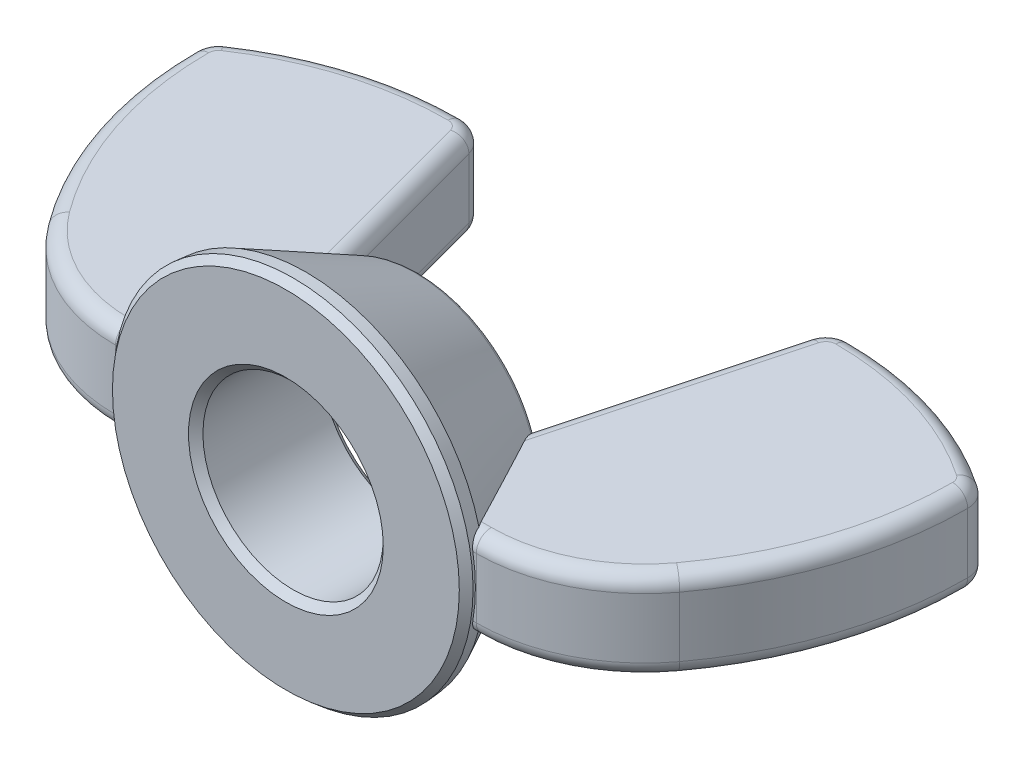
from build123d import *

# Parameters (mm, degrees)
EXTRUDE2_DEPTH      = 1.25
SKETCH3_R           = 5
EXTRUDE1_DEPTH      = 0.55566
EXTRUDE1_DRAFT      = -5
SKETCH15_R          = 4.951386049
EXTRUDE3_DEPTH      = 3.14874
EXTRUDE3_TAPER      = 26.698437176
FILLET3_R           = 0.254
SKETCH4_R           = 2.5
CUT_EXTRUDE1_DEPTH  = 16.684929072
SWEEP1_PITCH        = 0.8
SKETCH7_R           = 5
CUT_EXTRUDE2_DEPTH  = 16.684929104
SKETCH8_R           = 4.951386049
CUT_EXTRUDE3_DEPTH  = 14.546328962
SKETCH11_R          = 2.4492
CUT_EXTRUDE5_DEPTH  = 14.546328926
CUT_EXTRUDE5_TAPER  = 45
CHAMFER1_SIZE       = 0.2083725
CHAMFER1_SIZE2      = 0.192340809
FILLET4_R           = 0.416666667
SKETCH18_R          = 3.211270087
BOSS_EXTRUDE3_DEPTH = 3.7044
SKETCH19_R          = 2.5
CUT_EXTRUDE6_DEPTH  = 3.7044
CHAMFER2_SIZE       = 0.2


with BuildPart() as part:
    # Sketch13 → Extrude2 (new, symmetric)
    with BuildSketch(Plane(origin=(0, 0, 0), x_dir=(1, 0, 0), z_dir=(0, 1, 0))):
        with BuildLine():
            Line((3.074810737, 0.27783), (5, 0.27783))
            ThreePointArc((5, 0.27783), (7.099129938, 0.776746992), (8.749295866, 2.166789103))
            ThreePointArc((8.749295866, 2.166789103), (10.222034162, 5.009156698), (10.73, 8.169850029))
            ThreePointArc((10.73, 8.169850029), (10.648713606, 8.495871948), (10.423883961, 8.745570566))
            ThreePointArc((10.423883961, 8.745570566), (8.013491694, 9.895268701), (5.372282902, 10.29))
            ThreePointArc((5.372282902, 10.29), (4.94953191, 10.146495375), (4.701501078, 9.775291004))
            Line((4.701501078, 9.775291004), (3.074810737, 3.7044))
            Line((3.074810737, 3.7044), (3.074810737, 0.27783))
        make_face()
    extrude(amount=EXTRUDE2_DEPTH, both=True)

    # Fillet4
    fillet4_edges = [part.edges().sort_by_distance(p)[0] for p in [
        (7.099129938, 1.25, -0.776746992),
        (10.222034162, 1.25, -5.009156698),
        (10.648713606, 1.25, -8.495871948),
        (8.013491694, 1.25, -9.895268701),
        (4.94953191, 1.25, -10.146495375),
        (3.888155907, 1.25, -6.739845502),
        (3.888155907, -1.25, -6.739845502),
        (4.037405368, 1.25, -0.27783),
        (4.94953191, -1.25, -10.146495375),
        (8.013491694, -1.25, -9.895268701),
        (10.648713606, -1.25, -8.495871948),
        (10.222034162, -1.25, -5.009156698),
        (7.099129938, -1.25, -0.776746992),
        (4.037405368, -1.25, -0.27783),
    ]]
    fillet(fillet4_edges, radius=FILLET4_R)


with BuildPart() as body_2:
    # Sketch3 → Extrude1 (with draft: the straight prism first)
    with BuildSketch(Plane.XY):
        Circle(SKETCH3_R)
    extrude(amount=-EXTRUDE1_DEPTH)
    # Extrude1: the draft: its side faces are tilted about the plane it starts from
    extrude1_sides = [body_2.faces().sort_by_distance(p)[0] for p in [
        (-5, 0, -0.27783),
    ]]
    draft(extrude1_sides, Plane.XY, EXTRUDE1_DRAFT)

    # Sketch15 → Extrude3 (add)
    with BuildSketch(Plane(origin=(0, 0, -0.55566), x_dir=(-1, 0, 0), z_dir=(0, 0, -1))):
        Circle(SKETCH15_R)
    extrude(amount=EXTRUDE3_DEPTH, taper=EXTRUDE3_TAPER)

    # Fillet3
    fillet3_edges = [body_2.edges().sort_by_distance(p)[0] for p in [
        (3.367842423, 0, -3.7044),
    ]]
    fillet(fillet3_edges, radius=FILLET3_R)

    # Sketch4 → Cut-Extrude1 (cut, through all)
    with BuildSketch(Plane.XY):
        Circle(SKETCH4_R)
    extrude(amount=-CUT_EXTRUDE1_DEPTH, mode=Mode.SUBTRACT)

    # Sweep1: the profile of Sketch6 profile screwed along a right-hand helix of 7.1305 turns, 6 arcs to a turn; built about Z, then put on its axis
    sweep1_z = Axis((0, 0, 0), (0, 0, 1))
    sweep1_corners = [(2.5003, 0, -0.700173205), (1.980384758, 0, -0.4), (1.980384758, 0, -0.3), (2.5003, 0, 0.000173205)]
    with BuildLine(mode=Mode.PRIVATE) as sweep1_profile:
        Line(sweep1_corners[0], sweep1_corners[1])
        Line(sweep1_corners[1], sweep1_corners[2])
        Line(sweep1_corners[2], sweep1_corners[3])
        Line(sweep1_corners[3], sweep1_corners[0])
    sweep1_cap = Face(sweep1_profile.wire())
    sweep1_turn_angles = [0, 30, 60, 90, 120, 150, 180, 210, 240, 270, 300, 330, 360]
    sweep1_turn_weights = [1, 0.8660254037844387, 1, 0.8660254037844387, 1, 0.8660254037844387, 1, 0.8660254037844387, 1, 0.8660254037844387, 1, 0.8660254037844387, 1]
    sweep1_turn_rails = [Edge.make_bspline([Vector(p[0], p[1], 0).rotate(sweep1_z, sweep1_turn_angles[k]) / sweep1_turn_weights[k] + Vector(0, 0, p[2] + SWEEP1_PITCH * sweep1_turn_angles[k] / 360) for k in range(13)], [0, 0, 0, 1, 1, 2, 2, 3, 3, 4, 4, 5, 5, 6, 6, 6], 2, sweep1_turn_weights) for p in sweep1_corners]
    sweep1_turn_sides = [Face.make_surface_from_curves(sweep1_turn_rails[p[0]], sweep1_turn_rails[p[1]]) for p in [(0, 1), (1, 2), (2, 3), (3, 0)]]
    sweep1_last_angles = [2520, 2543.49, 2566.98]
    sweep1_last_weights = [1, 0.9171296552585544, 1]
    sweep1_last_rails = [Edge.make_bspline([Vector(p[0], p[1], 0).rotate(sweep1_z, sweep1_last_angles[k]) / sweep1_last_weights[k] + Vector(0, 0, p[2] + SWEEP1_PITCH * sweep1_last_angles[k] / 360) for k in range(3)], [0, 0, 0, 1, 1, 1], 2, sweep1_last_weights) for p in sweep1_corners]
    sweep1_last_sides = [Face.make_surface_from_curves(sweep1_last_rails[p[0]], sweep1_last_rails[p[1]]) for p in [(0, 1), (1, 2), (2, 3), (3, 0)]]
    sweep1 = Plane(origin=(0, 0, 0), x_dir=(-1, 0, 0), z_dir=(0, 0, -1)) * Solid(Shell([*[p.moved(Location((0, 0, SWEEP1_PITCH * i))) for i in range(7) for p in sweep1_turn_sides], *sweep1_last_sides, sweep1_cap, sweep1_cap.rotate(sweep1_z, 2566.98).moved(Location((0, 0, SWEEP1_PITCH * 2566.98 / 360)))]))
    add(sweep1)

    # Sketch7 → Cut-Extrude2 (cut, through all)
    with BuildSketch(Plane.XY):
        Circle(SKETCH7_R)
    extrude(amount=CUT_EXTRUDE2_DEPTH, mode=Mode.SUBTRACT)

    # Sketch8 → Cut-Extrude3 (cut, through all)
    with BuildSketch(Plane.XY.offset(-3.7044)):
        Circle(SKETCH8_R)
    extrude(amount=-CUT_EXTRUDE3_DEPTH, mode=Mode.SUBTRACT)

    # Cut-Extrude4 cone 1 section (through the dimple's axis) → Cut-Extrude4 (revolve, cut)
    with BuildSketch(Plane(origin=(0, 0, 0), x_dir=(0, -1, 0), z_dir=(1, 0, 0))):
        Polygon((0, 0), (2.5, 0), (0, 2.5), align=None)
    revolve(axis=Axis((0, 0, 0), (0, 0, -1)), mode=Mode.SUBTRACT)

    # Sketch11 → Cut-Extrude5 (cut, through all)
    with BuildSketch(Plane.XY.offset(-3.7044)):
        Circle(SKETCH11_R)
    extrude(amount=CUT_EXTRUDE5_DEPTH, taper=CUT_EXTRUDE5_TAPER, mode=Mode.SUBTRACT)

    # Chamfer1
    chamfer1_edges = [body_2.edges().sort_by_distance(p)[0] for p in [
        (-5, 0, 0),
    ]]
    chamfer1_side = [body_2.faces().sort_by_distance(p)[0] for p in [
        (-4.975693025, 0, -0.27783),
    ]]
    chamfer(chamfer1_edges, length=CHAMFER1_SIZE, length2=CHAMFER1_SIZE2, reference=chamfer1_side[0])


with BuildPart() as body_3:
    # Mirror6: mirrored copy
    add(part.part.mirror(Plane(origin=(0, 0, 0), x_dir=(0, 0, 1), z_dir=(1, 0, 0))))

    # Combine2: union part, body 2
    add(part.part)
    add(body_2.part)

    # Sketch18 → Boss-Extrude3 (add)
    with BuildSketch(Plane(origin=(0, 0, -3.7044), x_dir=(-1, 0, 0), z_dir=(0, 0, -1))):
        Circle(SKETCH18_R)
    extrude(amount=-BOSS_EXTRUDE3_DEPTH)

    # Sketch19 → Cut-Extrude6 (cut)
    with BuildSketch(Plane(origin=(0, 0, -3.7044), x_dir=(-1, 0, 0), z_dir=(0, 0, -1))):
        Circle(SKETCH19_R)
    extrude(amount=-CUT_EXTRUDE6_DEPTH, mode=Mode.SUBTRACT)

    # Chamfer2
    chamfer2_edges = [body_3.edges().sort_by_distance(p)[0] for p in [
        (2.5, 0, -3.7044),
        (2.5, 0, 0),
    ]]
    chamfer(chamfer2_edges, length=CHAMFER2_SIZE)


solid = body_3.part
